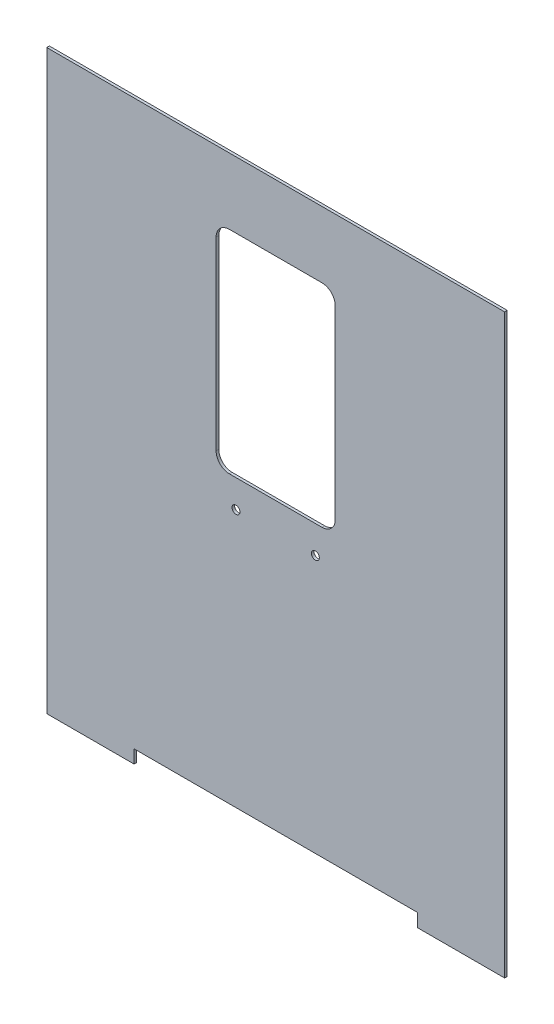
from build123d import *

# Parameters (mm, degrees)
T_LE_DE_BASE_PLI_E1_DEPTH = 1
ESQUISSE2_R               = 1.5
ESQUISSE2_W               = 45
ESQUISSE2_H               = 80
ENL_V_MAT_EXTRU_1_DEPTH   = 1
CONG_1_R                  = 5


# Sheet-metal steps are written as plain solids
with BuildPart() as part:
    # Esquisse1 → Tôle de base pliée1 (new body)
    with BuildSketch(Plane.XY):
        Polygon((53.5, 0), (86.5, 0), (86.5, 218), (-86.5, 218), (-86.5, 0), (-53.5, 0), (-53.5, 5), (53.5, 5), align=None)
    extrude(amount=-T_LE_DE_BASE_PLI_E1_DEPTH)

    # Esquisse2 → Enlèv. mat.-Extru.1 (cut)
    with BuildSketch(Plane.XY):
        with Locations((-15, 102.5)):
            Circle(ESQUISSE2_R)
        with Locations(Location((15, 102.5, 0), (0, 0, 180))):
            Circle(ESQUISSE2_R)
        with Locations((0, 153)):
            Rectangle(ESQUISSE2_W, ESQUISSE2_H)
    extrude(amount=-ENL_V_MAT_EXTRU_1_DEPTH, mode=Mode.SUBTRACT)

    # Congé1
    cong_1_edges = [part.edges().sort_by_distance(p)[0] for p in [
        (-22.5, 113, -0.5),
        (-22.5, 193, -0.5),
        (22.5, 193, -0.5),
        (22.5, 113, -0.5),
    ]]
    fillet(cong_1_edges, radius=CONG_1_R)


solid = part.part
